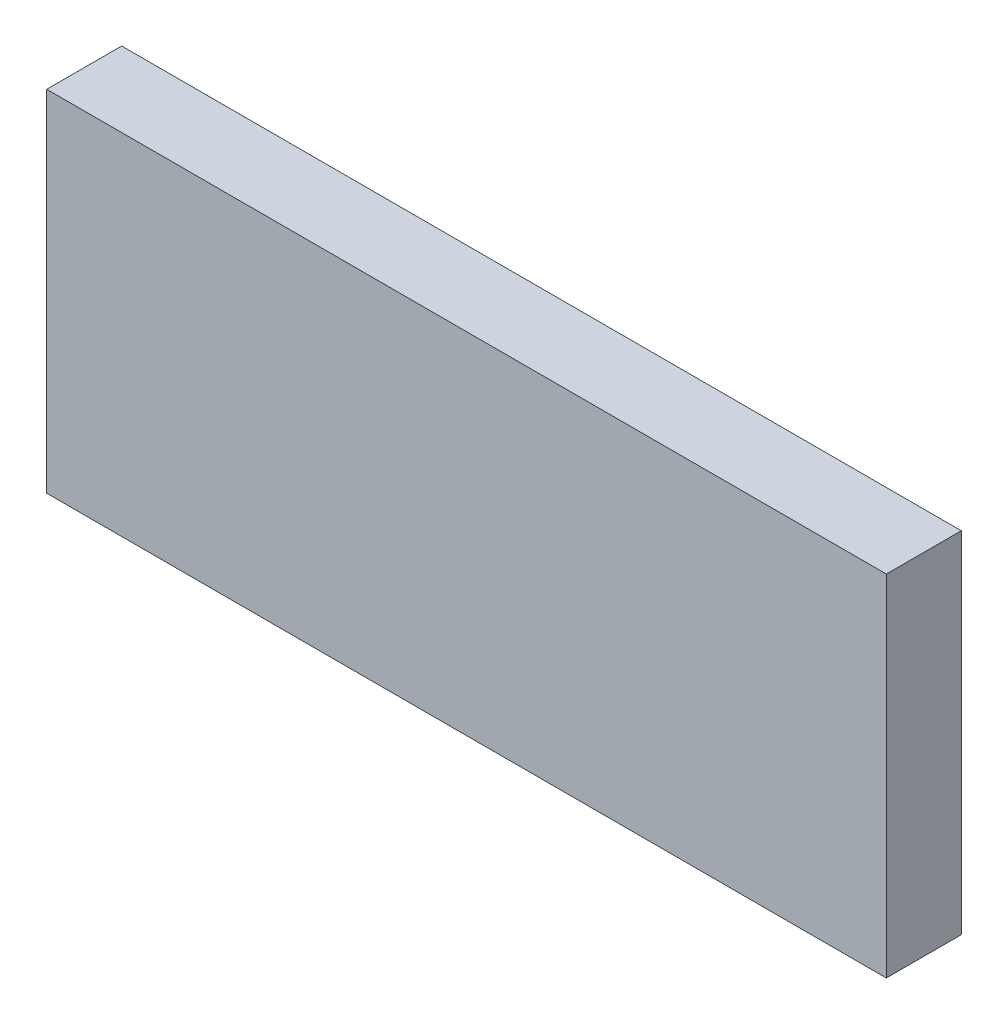
from build123d import *

# Parameters (mm, degrees)
SKETCH1_W           = 106.68
SKETCH1_H           = 44.45
BOSS_EXTRUDE1_DEPTH = 9.525


with BuildPart() as part:
    # Sketch1 → Boss-Extrude1 (new body)
    with BuildSketch(Plane.XY):
        Rectangle(SKETCH1_W, SKETCH1_H)
    extrude(amount=BOSS_EXTRUDE1_DEPTH)


solid = part.part
